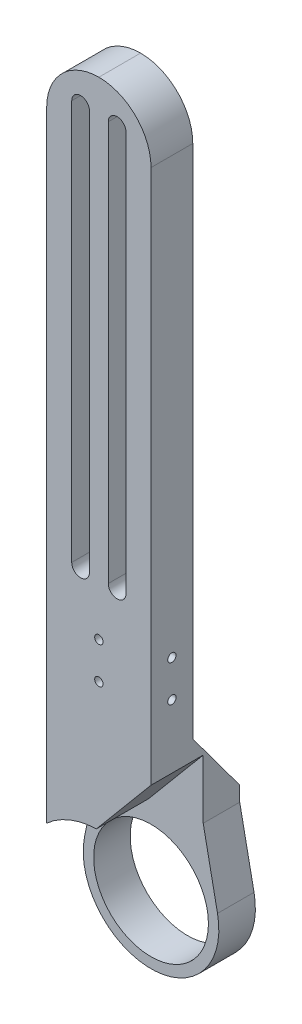
from build123d import *

# Parameters (mm, degrees)
SKETCH1_W                             = 140
SKETCH1_H                             = 20
BOSS_EXTRUDE1_DEPTH                   = 8
FILLET1_R                             = 10
TOP_SCREW_HOLES_AT_2_COUNT            = 2
TOP_SCREW_HOLES_AT_2_PITCH            = 7
SIDE_SCREW_HOLES_AT_2_COUNT           = 2
SIDE_SCREW_HOLES_AT_2_PITCH           = 7
BOSS_EXTRUDE2_START                   = -6
SKETCH23_R                            = 13
SKETCH23_R_2                          = 11
BOSS_EXTRUDE2_DEPTH                   = 7
CUT_EXTRUDE1_DEPTH                    = 4.5
CUT_EXTRUDE1_DEPTH_BACK               = 4.5
SKETCH23_4_R                          = 11
CUT_EXTRUDE2_START                    = -4
SKETCH23_5_R                          = 13
SKETCH23_5_R_2                        = 11
CUT_EXTRUDE2_DEPTH                    = 8
BOSS_EXTRUDE7_DEPTH                   = 9
CUT_EXTRUDE3_DEPTH                    = 11
CUT_EXTRUDE4_START                    = -2
CUT_EXTRUDE4_DEPTH                    = 2
BOSS_EXTRUDE3_START                   = -13
SKETCH24_R                            = 4
BOSS_EXTRUDE3_DEPTH                   = 9
BOSS_EXTRUDE4_START                   = -8
SKETCH25_R                            = 13
BOSS_EXTRUDE4_DEPTH                   = 8
SKETCH34_R                            = 5
BOSS_EXTRUDE9_DEPTH                   = 4
SKETCH39_R                            = 5
SKETCH39_R_2                          = 1.7
BOSS_EXTRUDE10_DEPTH                  = 2
BODY_MOVE_COPY1_OUTLINE_R             = 0.8
BODY_MOVE_COPY1_DEPTH                 = 3.1999999
BODY_MOVE_COPY1_START                 = 4.8000001
BODY_MOVE_COPY1_2_OUTLINE_R           = 0.8
BODY_MOVE_COPY1_2_DEPTH               = 3.1999999
BODY_MOVE_COPY1_START_2               = -9
BODY_MOVE_COPY1_3_OUTLINE_R           = 11
BODY_MOVE_COPY1_3_DEPTH               = 7
BODY_MOVE_COPY1_START_3               = -2
BODY_MOVE_COPY1_4_DEPTH               = 10
BODY_MOVE_COPY1_START_4               = 3.1999999
BODY_MOVE_COPY1_5_OUTLINE_R           = 0.8
BODY_MOVE_COPY1_5_DEPTH               = 1.6000002
CUT_EXTRUDE5_DEPTH                    = 9
BOSS_EXTRUDE11_DEPTH                  = 8
BOSS_EXTRUDE13_REACH                  = 87.012
BOSS_EXTRUDE13_DIRECTION_2_REACH      = 87.012
CUT_EXTRUDE6_DEPTH                    = 2.6
CUT_EXTRUDE7_START                    = -10
CUT_EXTRUDE7_DEPTH                    = 10
BODY_MOVE_COPY3_ANGLE                 = 170
BOSS_EXTRUDE14_REACH                  = 212.931
SKETCH46_W                            = 8.790313744
SKETCH46_H                            = 8
BOSS_EXTRUDE14_DIRECTION_2_REACH      = 212.931
BOSS_EXTRUDE14_DIRECTION_2_END_RADIUS = 13
BODY_MOVE_COPY4_ANGLE                 = 10


with BuildPart() as part:
    # Sketch1 → Boss-Extrude1 (new body)
    with BuildSketch(Plane(origin=(0, 0, 0), x_dir=(0, 1, 0), z_dir=(0, 0, 1))):
        Rectangle(SKETCH1_W, SKETCH1_H)
        with BuildLine():
            Line((-13.14, 5.2), (63.5, 5.2))
            ThreePointArc((63.5, 5.2), (65.2, 3.5), (63.5, 1.8))
            Line((63.5, 1.8), (-13.14, 1.8))
            ThreePointArc((-13.14, 1.8), (-14.84, 3.5), (-13.14, 5.2))
        make_face(mode=Mode.SUBTRACT)
        with BuildLine():
            Line((-13.14, -1.8), (63.5, -1.8))
            ThreePointArc((63.5, -1.8), (65.2, -3.5), (63.5, -5.2))
            Line((63.5, -5.2), (-13.14, -5.2))
            ThreePointArc((-13.14, -5.2), (-14.84, -3.5), (-13.14, -1.8))
        make_face(mode=Mode.SUBTRACT)
    extrude(amount=BOSS_EXTRUDE1_DEPTH)

    # Fillet1
    fillet1_edges = [part.edges().sort_by_distance(p)[0] for p in [
        (-10, 70, 4),
        (10, 70, 4),
    ]]
    fillet(fillet1_edges, radius=FILLET1_R - 0.0001)  # a hair under: the kernel refuses the full size

    # Sketch19 → Top - Screw Holes (revolve, cut)
    with BuildSketch(Plane(origin=(0, -23.34, 8), x_dir=(0, -1, 0), z_dir=(1, 0, 0))):
        Polygon((0, 0), (0, 5.680688495), (0.8, 5.2), (0.8, 0), align=None)
    top_screw_holes = revolve(axis=Axis((0, -23.34, 14.35), (0, 0, -1)), mode=Mode.SUBTRACT)

    # Top - Screw Holes at 2: Top - Screw Holes ×2
    with Locations(*[(0, -i * TOP_SCREW_HOLES_AT_2_PITCH, 0) for i in range(1, TOP_SCREW_HOLES_AT_2_COUNT)]):
        add(top_screw_holes, mode=Mode.SUBTRACT)

    # Sketch21 → Side - Screw Holes (revolve, cut)
    with BuildSketch(Plane(origin=(-10, -23.34, 4), x_dir=(0, 0, 1), z_dir=(0, 1, 0))):
        Polygon((0, 0), (0, 5.680688495), (0.8, 5.2), (0.8, 0), align=None)
    side_screw_holes = revolve(axis=Axis((-16.35, -23.34, 4), (1, 0, 0)), mode=Mode.SUBTRACT)

    # Side - Screw Holes at 2: Side - Screw Holes ×2
    with Locations(*[(0, -i * SIDE_SCREW_HOLES_AT_2_PITCH, 0) for i in range(1, SIDE_SCREW_HOLES_AT_2_COUNT)]):
        add(side_screw_holes, mode=Mode.SUBTRACT)

    # Mirror1: Side - Screw Holes across plane
    add(side_screw_holes.mirror(Plane(origin=(0, 0, 0), x_dir=(0, 0, 1), z_dir=(1, 0, 0))), mode=Mode.SUBTRACT)

    # Mirror1 copy 1 sketch → Mirror1 copy 1 (revolve, cut)
    with BuildSketch(Plane(origin=(10, -30.34, 4), x_dir=(0, 0, 1), z_dir=(0, 1, 0))):
        Polygon((0, 0), (0, -5.680688495), (0.8, -5.2), (0.8, 0), align=None)
    revolve(axis=Axis((16.35, -30.34, 4), (1, 0, 0)), mode=Mode.SUBTRACT)

    # Mirror2: Top - Screw Holes across plane
    add(top_screw_holes.mirror(Plane.XY.offset(4)), mode=Mode.SUBTRACT)

    # Mirror2 copy 1 sketch → Mirror2 copy 1 (revolve, cut)
    with BuildSketch(Plane(origin=(0, -30.34, 0), x_dir=(0, -1, 0), z_dir=(1, 0, 0))):
        Polygon((0, 0), (0, -5.680688495), (0.8, -5.2), (0.8, 0), align=None)
    revolve(axis=Axis((0, -30.34, -6.35), (0, 0, -1)), mode=Mode.SUBTRACT)

    # Sketch23<4> → Cut-Extrude1 (cut, two sides: drawn at the far end of the back side and taken through both)
    with BuildSketch(Plane(origin=(0, 0, 4), x_dir=(0, -1, 0), z_dir=(0, 0, 1)).offset(-CUT_EXTRUDE1_DEPTH_BACK)):
        with Locations(Location((70, 0, 0), (0, 0, 90))):
            Circle(SKETCH23_4_R)
    extrude(amount=CUT_EXTRUDE1_DEPTH + CUT_EXTRUDE1_DEPTH_BACK, mode=Mode.SUBTRACT)

    # Sketch23<5> → Cut-Extrude2 (cut)
    with BuildSketch(Plane(origin=(0, 0, 4), x_dir=(0, -1, 0), z_dir=(0, 0, 1)).offset(CUT_EXTRUDE2_START)):
        with Locations(Location((70, 0, 0), (0, 0, 90))):
            Circle(SKETCH23_5_R)
        with Locations(Location((70, 0, 0), (0, 0, 90))):
            Circle(SKETCH23_5_R_2, mode=Mode.SUBTRACT)
    extrude(amount=CUT_EXTRUDE2_DEPTH, mode=Mode.SUBTRACT)



with BuildPart() as body_2:
    # Sketch23 → Boss-Extrude2 (new body)
    with BuildSketch(Plane(origin=(0, 0, 4), x_dir=(0, -1, 0), z_dir=(0, 0, 1)).offset(BOSS_EXTRUDE2_START)):
        with Locations(Location((70, 0, 0), (0, 0, 90))):
            Circle(SKETCH23_R)
        with Locations(Location((70, 0, 0), (0, 0, 90))):
            Circle(SKETCH23_R_2, mode=Mode.SUBTRACT)
    extrude(amount=-BOSS_EXTRUDE2_DEPTH)


with BuildPart() as part_1:
    add(part.part)

    add(body_2.part)  # Boss-Extrude7 merges body 2
    # Sketch29 → Boss-Extrude7 (add)
    with BuildSketch(Plane(origin=(0, 0, 0), x_dir=(1, 0, 0), z_dir=(0, 0, -1))):
        with BuildLine():
            ThreePointArc((-10, 53.844505579), (0, 51), (10, 53.844505579))
            Line((10, 53.844505579), (10, 61.693376137))
            ThreePointArc((10, 61.693376137), (0, 57), (-10, 61.693376137))
            Line((-10, 61.693376137), (-10, 53.844505579))
        make_face()
        with BuildLine():
            Line((-12.742776356, 67.426743165), (-10, 53.844505579))
            Line((-10, 53.844505579), (-10, 61.693376137))
            ThreePointArc((-10, 61.693376137), (-11.727162635, 64.389861273), (-12.742776356, 67.426743165))
        make_face()
        with BuildLine():
            Line((10, 61.693376137), (10, 53.844505579))
            Line((10, 53.844505579), (12.742776356, 67.426743165))
            ThreePointArc((12.742776356, 67.426743165), (11.727162635, 64.389861273), (10, 61.693376137))
        make_face()
    extrude(amount=BOSS_EXTRUDE7_DEPTH)

    # Cut-Extrude3: read off the stored shape, not the designer's step
    # Cut-Extrude3 outline → Cut-Extrude3 (cut)
    with BuildSketch(Plane.XY.offset(-2)):
        with BuildLine():
            ThreePointArc((11.261507826, -60.091496507), (0, -55), (-11.261507826, -60.091496507))
            Line((-11.261507826, -60.091496507), (-12.742776356, -67.426743165))
            ThreePointArc((-12.742776356, -67.426743165), (0, -57), (12.742776356, -67.426743165))
            Line((12.742776356, -67.426743165), (11.261507826, -60.091496507))
        make_face()
    extrude(amount=CUT_EXTRUDE3_DEPTH, mode=Mode.SUBTRACT)

    # Sketch30 → Cut-Extrude4 (cut)
    with BuildSketch(Plane.XY.offset(CUT_EXTRUDE4_START)):
        with BuildLine():
            Line((-10, -58.819660113), (-10, -53.844505579))
            Line((-10, -53.844505579), (-11.261507826, -60.091496507))
            ThreePointArc((-11.261507826, -60.091496507), (-10.649756838, -59.436729707), (-10, -58.819660113))
        make_face()
        with BuildLine():
            Line((11.261507826, -60.091496507), (10, -53.844505579))
            Line((10, -53.844505579), (10, -58.819660113))
            ThreePointArc((10, -58.819660113), (10.649756838, -59.436729707), (11.261507826, -60.091496507))
        make_face()
    extrude(amount=CUT_EXTRUDE4_DEPTH, mode=Mode.SUBTRACT)

    # Boss-Extrude13: up to this face of the body (flat: up to its plane)
    boss_extrude13_end = Plane(part_1.part.faces().sort_by_distance((10, 0.113380243, 3.94798514))[0])
    # Sketch43 → Boss-Extrude13 (add, up to the picked face)
    with BuildSketch(Plane.YZ, mode=Mode.PRIVATE) as boss_extrude13_sk1:
        Polygon((-51, -9), (-38.844505579, 0), (-51, 0), (-53.844505579, 0), (-53.844505579, -9), align=None)
    boss_extrude13_tool1 = split(extrude(boss_extrude13_sk1.sketch, amount=BOSS_EXTRUDE13_REACH, mode=Mode.PRIVATE), bisect_by=boss_extrude13_end, keep=Keep.BOTH, mode=Mode.PRIVATE)
    add(boss_extrude13_tool1.solids().sort_by(Axis((0, -48.693363, -3.478215), (1, 0, 0)))[0])

    # Boss-Extrude13 direction 2: up to this face of the body (flat: up to its plane)
    boss_extrude13_direction_2_end = Plane(part_1.part.faces().sort_by_distance((-10, 0.113380243, 3.94798514))[0])
    # Sketch43 → Boss-Extrude13 direction 2 (add, up to the picked face)
    with BuildSketch(Plane.YZ, mode=Mode.PRIVATE) as boss_extrude13_direction_2_sk1:
        Polygon((-51, -9), (-38.844505579, 0), (-51, 0), (-53.844505579, 0), (-53.844505579, -9), align=None)
    boss_extrude13_direction_2_tool1 = split(extrude(boss_extrude13_direction_2_sk1.sketch, amount=-BOSS_EXTRUDE13_DIRECTION_2_REACH, mode=Mode.PRIVATE), bisect_by=boss_extrude13_direction_2_end, keep=Keep.BOTH, mode=Mode.PRIVATE)
    add(boss_extrude13_direction_2_tool1.solids().sort_by(Axis((0, -48.693363, -3.478215), (-1, 0, 0)))[0])

    # Sketch45 → Cut-Extrude7 (cut)
    with BuildSketch(Plane.XY.offset(8).offset(CUT_EXTRUDE7_START)):
        with BuildLine():
            Line((10, -42.525225805), (-0.473860479, -55.00748666))
            ThreePointArc((-0.473860479, -55.00748666), (5.13030215, -55.904610688), (10, -58.819660113))
            Line((10, -58.819660113), (10, -42.525225805))
        make_face()
    extrude(amount=CUT_EXTRUDE7_DEPTH, mode=Mode.SUBTRACT)


with BuildPart() as body_2_2:
    # Sketch24 → Boss-Extrude3 (new body)
    with BuildSketch(Plane(origin=(0, 0, 4), x_dir=(0, -1, 0), z_dir=(0, 0, 1)).offset(BOSS_EXTRUDE3_START)):
        with Locations(Location((70, 0, 0), (0, 0, 90))):
            Circle(SKETCH24_R)
    extrude(amount=BOSS_EXTRUDE3_DEPTH)

    # Sketch25 → Boss-Extrude4 (add)
    with BuildSketch(Plane(origin=(0, 0, 0), x_dir=(1, 0, 0), z_dir=(0, 0, -1)).offset(BOSS_EXTRUDE4_START)):
        with Locations(Location((0, 70, 0), (0, 0, 180))):
            Circle(SKETCH25_R)
    extrude(amount=BOSS_EXTRUDE4_DEPTH)


with BuildPart() as body_3:
    # Sketch34 → Boss-Extrude9 (new body)
    with BuildSketch(Plane(origin=(0, 0, -9), x_dir=(1, 0, 0), z_dir=(0, 0, -1))):
        with Locations(Location((0, 70, 0), (0, 0, 180))):
            Circle(SKETCH34_R)
    extrude(amount=BOSS_EXTRUDE9_DEPTH)


with BuildPart() as csk_for_m3_countersunk_flat_head_screw1_tool:
    # Sketch38 → CSK for M3 Countersunk Flat Head Screw1 (revolve)
    with BuildSketch(Plane(origin=(0, -70, -13), x_dir=(0, 1, 0), z_dir=(1, 0, 0))):
        Polygon((0, 0), (0, 21), (1.7, 21), (1.7, 1.45), (3.15, 0), align=None)
    revolve(axis=Axis((0, -70, -19.35), (0, 0, 1)))


with BuildPart() as body_2_2_1:
    add(body_2_2.part)

    # CSK for M3 Countersunk Flat Head Screw1: cut by csk_for_m3_countersunk_flat_head_screw1_tool
    add(csk_for_m3_countersunk_flat_head_screw1_tool.part, mode=Mode.SUBTRACT)

    # Sketch39 → Boss-Extrude10 (add)
    with BuildSketch(Plane(origin=(0, 0, 0), x_dir=(1, 0, 0), z_dir=(0, 0, -1))):
        with Locations(Location((0, 70, 0), (0, 0, 180))):
            Circle(SKETCH39_R)
        with Locations(Location((0, 70, 0), (0, 0, 180))):
            Circle(SKETCH39_R_2, mode=Mode.SUBTRACT)
    extrude(amount=BOSS_EXTRUDE10_DEPTH)



with BuildPart() as body_3_1:
    add(body_3.part)

    # CSK for M3 Countersunk Flat Head Screw1: cut by csk_for_m3_countersunk_flat_head_screw1_tool
    add(csk_for_m3_countersunk_flat_head_screw1_tool.part, mode=Mode.SUBTRACT)


with BuildPart() as body_4:
    # Body-Move/Copy1: read off the stored shape, not the designer's step
    # Body-Move/Copy1 outline → Body-Move/Copy1 (new body)
    with BuildSketch(Plane.XY):
        with BuildLine():
            Line((10, -58.819660113), (10, 60))
            ThreePointArc((10, 60), (7.071067812, 67.071067812), (0, 70))
            ThreePointArc((0, 70), (-7.071067812, 67.071067812), (-10, 60))
            Line((-10, 60), (-10, -58.819660113))
            ThreePointArc((-10, -58.819660113), (0, -55), (10, -58.819660113))
        make_face()
        with BuildLine():
            ThreePointArc((1.8, 63.5), (3.5, 65.2), (5.2, 63.5))
            Line((5.2, 63.5), (5.2, -13.14))
            ThreePointArc((5.2, -13.14), (3.5, -14.84), (1.8, -13.14))
            Line((1.8, -13.14), (1.8, 63.5))
        make_face(mode=Mode.SUBTRACT)
        with Locations((0, -30.34)):
            Circle(BODY_MOVE_COPY1_OUTLINE_R, mode=Mode.SUBTRACT)
        with Locations((0, -23.34)):
            Circle(BODY_MOVE_COPY1_OUTLINE_R, mode=Mode.SUBTRACT)
        with BuildLine():
            Line((-5.2, -13.14), (-5.2, 63.5))
            ThreePointArc((-5.2, 63.5), (-3.5, 65.2), (-1.8, 63.5))
            Line((-1.8, 63.5), (-1.8, -13.14))
            ThreePointArc((-1.8, -13.14), (-3.5, -14.84), (-5.2, -13.14))
        make_face(mode=Mode.SUBTRACT)
    extrude(amount=BODY_MOVE_COPY1_DEPTH)

    # Body-Move_Copy1 2 outline → Body-Move_Copy1 2 (add)
    with BuildSketch(Plane.XY.offset(BODY_MOVE_COPY1_START)):
        with BuildLine():
            Line((10, -58.819660113), (10, 60))
            ThreePointArc((10, 60), (7.071067812, 67.071067812), (0, 70))
            ThreePointArc((0, 70), (-7.071067812, 67.071067812), (-10, 60))
            Line((-10, 60), (-10, -58.819660113))
            ThreePointArc((-10, -58.819660113), (0, -55), (10, -58.819660113))
        make_face()
        with BuildLine():
            ThreePointArc((1.8, 63.5), (3.5, 65.2), (5.2, 63.5))
            Line((5.2, 63.5), (5.2, -13.14))
            ThreePointArc((5.2, -13.14), (3.5, -14.84), (1.8, -13.14))
            Line((1.8, -13.14), (1.8, 63.5))
        make_face(mode=Mode.SUBTRACT)
        with Locations((0, -30.34)):
            Circle(BODY_MOVE_COPY1_2_OUTLINE_R, mode=Mode.SUBTRACT)
        with Locations((0, -23.34)):
            Circle(BODY_MOVE_COPY1_2_OUTLINE_R, mode=Mode.SUBTRACT)
        with BuildLine():
            Line((-5.2, -13.14), (-5.2, 63.5))
            ThreePointArc((-5.2, 63.5), (-3.5, 65.2), (-1.8, 63.5))
            Line((-1.8, 63.5), (-1.8, -13.14))
            ThreePointArc((-1.8, -13.14), (-3.5, -14.84), (-5.2, -13.14))
        make_face(mode=Mode.SUBTRACT)
    extrude(amount=BODY_MOVE_COPY1_2_DEPTH)

    # Body-Move_Copy1 3 outline → Body-Move_Copy1 3 (add)
    with BuildSketch(Plane.XY.offset(BODY_MOVE_COPY1_START_2)):
        with BuildLine():
            Line((12.742776356, -67.426743165), (10, -53.844505579))
            ThreePointArc((10, -53.844505579), (0, -51), (-10, -53.844505579))
            Line((-10, -53.844505579), (-12.742776356, -67.426743165))
            ThreePointArc((-12.742776356, -67.426743165), (0, -83), (12.742776356, -67.426743165))
        make_face()
        with Locations((0, -70)):
            Circle(BODY_MOVE_COPY1_3_OUTLINE_R, mode=Mode.SUBTRACT)
    extrude(amount=BODY_MOVE_COPY1_3_DEPTH)

    # Body-Move_Copy1 4 outline → Body-Move_Copy1 4 (add)
    with BuildSketch(Plane.XY.offset(BODY_MOVE_COPY1_START_3)):
        with BuildLine():
            ThreePointArc((10, -53.844505579), (0, -51), (-10, -53.844505579))
            Line((-10, -53.844505579), (-10, -58.819660113))
            ThreePointArc((-10, -58.819660113), (0, -55), (10, -58.819660113))
            Line((10, -58.819660113), (10, -53.844505579))
        make_face()
    extrude(amount=BODY_MOVE_COPY1_4_DEPTH)

    # Body-Move_Copy1 5 outline → Body-Move_Copy1 5 (add)
    with BuildSketch(Plane.XY.offset(BODY_MOVE_COPY1_START_4)):
        with BuildLine():
            Line((10, -53.844505579), (10, 60))
            ThreePointArc((10, 60), (7.071067812, 67.071067812), (0, 70))
            ThreePointArc((0, 70), (-7.071067812, 67.071067812), (-10, 60))
            Line((-10, 60), (-10, -53.844505579))
            ThreePointArc((-10, -53.844505579), (0, -51), (10, -53.844505579))
        make_face()
        with Locations((0, -30.34)):
            Circle(BODY_MOVE_COPY1_5_OUTLINE_R, mode=Mode.SUBTRACT)
        with Locations((0, -23.34)):
            Circle(BODY_MOVE_COPY1_5_OUTLINE_R, mode=Mode.SUBTRACT)
        with BuildLine():
            Line((-5.2, -13.14), (-5.2, 63.5))
            ThreePointArc((-5.2, 63.5), (-3.5, 65.2), (-1.8, 63.5))
            Line((-1.8, 63.5), (-1.8, -13.14))
            ThreePointArc((-1.8, -13.14), (-3.5, -14.84), (-5.2, -13.14))
        make_face(mode=Mode.SUBTRACT)
        with BuildLine():
            Line((1.8, -13.14), (1.8, 63.5))
            ThreePointArc((1.8, 63.5), (3.5, 65.2), (5.2, 63.5))
            Line((5.2, 63.5), (5.2, -13.14))
            ThreePointArc((5.2, -13.14), (3.5, -14.84), (1.8, -13.14))
        make_face(mode=Mode.SUBTRACT)
    extrude(amount=BODY_MOVE_COPY1_5_DEPTH)

    # Body-Move_Copy1 6 outline → Body-Move_Copy1 6 (revolve, cut)
    with BuildSketch(Plane(origin=(0, -30.34, 4), x_dir=(0, 1, 0), z_dir=(0, 0, -1))):
        Polygon((0.8, -4.8), (0, -4.319311505), (0, -10), (0.8, -10), align=None)
        Polygon((0, 10), (0, 4.319311505), (0.8, 4.8), (0.8, 10), align=None)
    revolve(axis=Axis((0, -30.34, 4), (1, 0, 0)), mode=Mode.SUBTRACT)

    # Body-Move_Copy1 7 outline → Body-Move_Copy1 7 (revolve, cut)
    with BuildSketch(Plane(origin=(0, -23.34, 4), x_dir=(0, 1, 0), z_dir=(0, 0, -1))):
        Polygon((0.8, -4.8), (0, -4.319311505), (0, -10), (0.8, -10), align=None)
        Polygon((0, 10), (0, 4.319311505), (0.8, 4.8), (0.8, 10), align=None)
    revolve(axis=Axis((0, -23.34, 4), (1, 0, 0)), mode=Mode.SUBTRACT)

    # Sketch40 → Cut-Extrude5 (cut)
    with BuildSketch(Plane(origin=(0, 0, 0), x_dir=(1, 0, 0), z_dir=(0, 0, -1))):
        with BuildLine():
            Line((-12.742776356, 67.426743165), (-10, 53.844505579))
            ThreePointArc((-10, 53.844505579), (0, 51), (10, 53.844505579))
            Line((10, 53.844505579), (12.742776356, 67.426743165))
            ThreePointArc((12.742776356, 67.426743165), (0, 83), (-12.742776356, 67.426743165))
        make_face()
    extrude(amount=CUT_EXTRUDE5_DEPTH, mode=Mode.SUBTRACT)


with BuildPart() as body_2_2_2:
    add(body_2_2_1.part)

    add(body_4.part)  # Boss-Extrude11 merges body 4
    # Boss-Extrude11: read off the stored shape, not the designer's step
    # Boss-Extrude11 outline → Boss-Extrude11 (add)
    with BuildSketch(Plane.XY):
        with BuildLine():
            ThreePointArc((-10, -61.693376137), (0, -57), (10, -61.693376137))
            Line((10, -61.693376137), (10, -58.819660113))
            ThreePointArc((10, -58.819660113), (0, -55), (-10, -58.819660113))
            Line((-10, -58.819660113), (-10, -61.693376137))
        make_face()
    extrude(amount=BOSS_EXTRUDE11_DEPTH)

    # Sketch44 → Cut-Extrude6 (cut)
    with BuildSketch(Plane.XY.offset(8)):
        Polygon((3.798964771, -70), (1.899482386, -66.71), (-1.899482386, -66.71), (-3.798964771, -70), (-1.899482386, -73.29), (1.899482386, -73.29), align=None)
    extrude(amount=-CUT_EXTRUDE6_DEPTH, mode=Mode.SUBTRACT)


with BuildPart() as body_2_2_3:
    # Body-Move/Copy3: moved
    add(body_2_2_2.part.rotate(Axis((0, -70, 0), (0, 0, 1)), BODY_MOVE_COPY3_ANGLE))

    # Boss-Extrude14: up to this plane
    boss_extrude14_end = Plane(origin=(0.839061186, -0.169438737, -39.320806191), z_dir=(-0.9802135658563201, 0.1979428334424811, 0))
    # Sketch46 → Boss-Extrude14 (add, up to the surface)
    with BuildSketch(Plane(origin=(2.122627486, -0.374276496, 0), x_dir=(-0.17364817766692428, -0.9848077530122092, 1.2297632139214586e-15), z_dir=(-0.9848077530122092, 0.17364817766692428, 0)), mode=Mode.PRIVATE) as boss_extrude14_sk1:
        with Locations((64.057695957, 4)):
            Rectangle(SKETCH46_W, SKETCH46_H)
    boss_extrude14_tool1 = split(extrude(boss_extrude14_sk1.sketch, amount=BOSS_EXTRUDE14_REACH, mode=Mode.PRIVATE), bisect_by=boss_extrude14_end, keep=Keep.BOTH, mode=Mode.PRIVATE)
    add(boss_extrude14_tool1.solids().sort_by_distance((-9.000875, -63.458792, 4))[0])

    # Boss-Extrude14 direction 2: up to this cylinder (the profile starts outside it)
    boss_extrude14_direction_2_end = Plane(origin=(0, -70, 4), z_dir=(0, 0, -1)) * Cylinder(BOSS_EXTRUDE14_DIRECTION_2_END_RADIUS, 452.862, mode=Mode.PRIVATE)
    # Sketch46 → Boss-Extrude14 direction 2 (add, up to the surface)
    with BuildSketch(Plane(origin=(2.122627486, -0.374276496, 0), x_dir=(-0.17364817766692428, -0.9848077530122092, 1.2297632139214586e-15), z_dir=(-0.9848077530122092, 0.17364817766692428, 0)), mode=Mode.PRIVATE) as boss_extrude14_direction_2_sk1:
        with Locations((64.057695957, 4)):
            Rectangle(SKETCH46_W, SKETCH46_H)
    boss_extrude14_direction_2_tool1 = extrude(boss_extrude14_direction_2_sk1.sketch, amount=-BOSS_EXTRUDE14_DIRECTION_2_REACH, mode=Mode.PRIVATE) - boss_extrude14_direction_2_end
    add(boss_extrude14_direction_2_tool1.solids().sort_by_distance((-9.000875, -63.458792, 4))[0])


with BuildPart() as body_2_2_4:
    # Body-Move/Copy4: moved
    add(body_2_2_3.part.rotate(Axis((0, -70, 0), (0, 0, 1)), BODY_MOVE_COPY4_ANGLE))


solid = part_1.part
